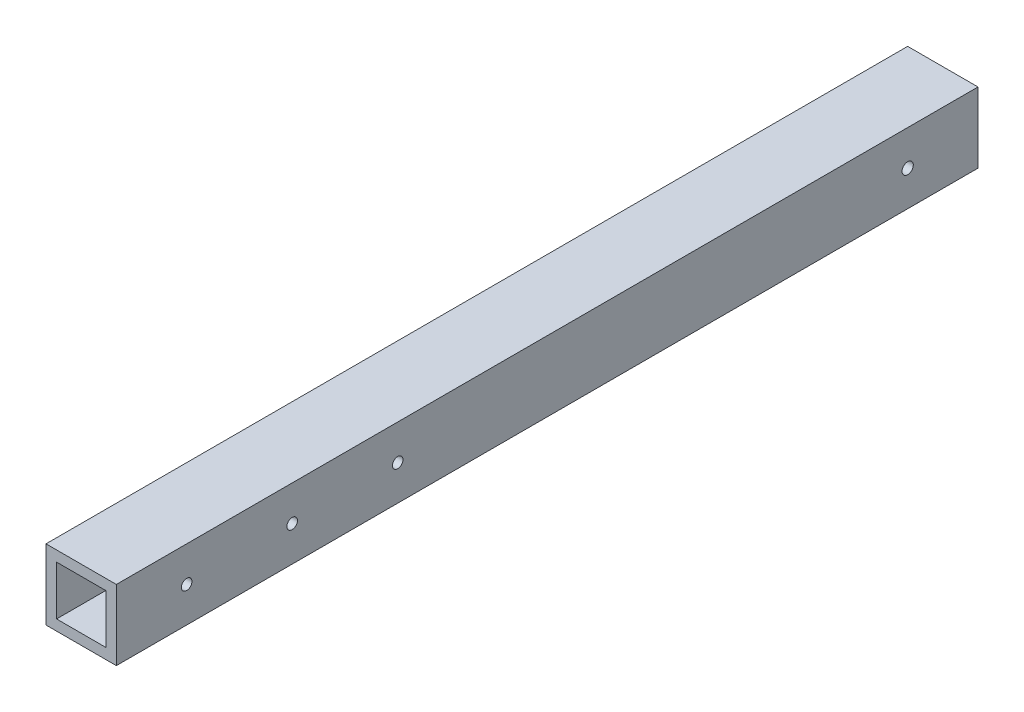
from build123d import *

# Parameters (mm, degrees)
SKETCH_1_W          = 20
SKETCH_1_H          = 20
EXTRUDE_1_DEPTH     = 245
SKETCH_2_W          = 14
SKETCH_2_H          = 14
CUT_EXTRUDE_1_DEPTH = 246.478946274
SKETCH_3_R          = 1.5
SKETCH_3_R_2        = 1.6
CUT_EXTRUDE_2_DEPTH = 80


with BuildPart() as part:
    # 草图1 → 凸台-拉伸1 (new body)
    with BuildSketch(Plane.XY):
        with Locations((0.666666667, 1.006147649)):
            Rectangle(SKETCH_1_W, SKETCH_1_H)
    extrude(amount=EXTRUDE_1_DEPTH)

    # 草图2 → 切除-拉伸1 (cut, through all)
    with BuildSketch(Plane(origin=(0, 0, 0), x_dir=(-1, 0, 0), z_dir=(0, 0, -1))):
        with Locations((-0.666666667, 1.006147649)):
            Rectangle(SKETCH_2_W, SKETCH_2_H)
    extrude(amount=-CUT_EXTRUDE_1_DEPTH, mode=Mode.SUBTRACT)

    # 草图3 → 切除-拉伸2 (cut)
    with BuildSketch(Plane.ZY.offset(9.333333333)):
        with Locations((225, 1.006147649)):
            Circle(SKETCH_3_R)
        with Locations((195, 1.006147649)):
            Circle(SKETCH_3_R)
        with Locations((165, 1.006147649)):
            Circle(SKETCH_3_R)
        with Locations((20, 1.006147649)):
            Circle(SKETCH_3_R_2)
    extrude(amount=-CUT_EXTRUDE_2_DEPTH, mode=Mode.SUBTRACT)


solid = part.part
